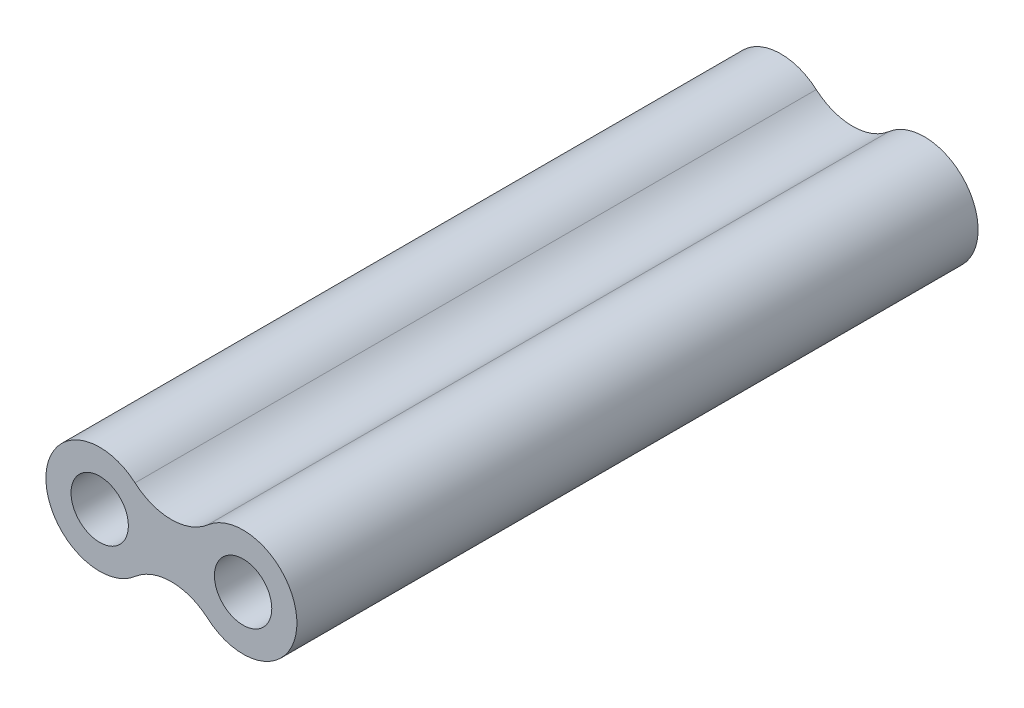
from build123d import *

# Parameters (mm, degrees)
SKETCH1_R                       = 3
BOSS_EXTRUDE1_DEPTH             = 19
M3_CLEARANCE_HOLE1_D            = 3.2
BOSS_EXTRUDE2_REACH             = 21.468
BOSS_EXTRUDE2_DIRECTION_2_REACH = 21.468
M3_CLEARANCE_HOLE2_D            = 3.2


with BuildPart() as part:
    # Sketch1 → Boss-Extrude1 (new, symmetric)
    with BuildSketch(Plane.XY):
        Circle(SKETCH1_R)
    extrude(amount=BOSS_EXTRUDE1_DEPTH, both=True)

    # M3 Clearance Hole1 (through all)
    with Locations(Plane.XY.offset(19)):
        with Locations((0, 0)):
            Hole(M3_CLEARANCE_HOLE1_D / 2)

    # Boss-Extrude2: up to this face of the body (flat: up to its plane)
    boss_extrude2_end = Plane(part.part.faces().sort_by_distance((-2.915147186, 0, 19))[0])
    # Sketch2 → Boss-Extrude2 (add, up to the picked face)
    with BuildSketch(Plane.XY, mode=Mode.PRIVATE) as boss_extrude2_sk1:
        with BuildLine():
            ThreePointArc((6.02739726, -2.260273973), (11, 0), (6.02739726, 2.260273973))
            ThreePointArc((6.02739726, 2.260273973), (4, 1.5), (1.97260274, 2.260273973))
            ThreePointArc((1.97260274, 2.260273973), (3, 0), (1.97260274, -2.260273973))
            ThreePointArc((1.97260274, -2.260273973), (4, -1.5), (6.02739726, -2.260273973))
        make_face()
    boss_extrude2_tool1 = split(extrude(boss_extrude2_sk1.sketch, amount=BOSS_EXTRUDE2_REACH, mode=Mode.PRIVATE), bisect_by=boss_extrude2_end, keep=Keep.BOTH, mode=Mode.PRIVATE)
    add(boss_extrude2_tool1.solids().sort_by(Axis((7.146911, 0, 0), (0, 0, 1)))[0])

    # Boss-Extrude2 direction 2: up to this face of the body (flat: up to its plane)
    boss_extrude2_direction_2_end = Plane(part.part.faces().sort_by_distance((-2.915147186, 0, -19))[0])
    # Sketch2 → Boss-Extrude2 direction 2 (add, up to the picked face)
    with BuildSketch(Plane.XY, mode=Mode.PRIVATE) as boss_extrude2_direction_2_sk1:
        with BuildLine():
            ThreePointArc((6.02739726, -2.260273973), (11, 0), (6.02739726, 2.260273973))
            ThreePointArc((6.02739726, 2.260273973), (4, 1.5), (1.97260274, 2.260273973))
            ThreePointArc((1.97260274, 2.260273973), (3, 0), (1.97260274, -2.260273973))
            ThreePointArc((1.97260274, -2.260273973), (4, -1.5), (6.02739726, -2.260273973))
        make_face()
    boss_extrude2_direction_2_tool1 = split(extrude(boss_extrude2_direction_2_sk1.sketch, amount=-BOSS_EXTRUDE2_DIRECTION_2_REACH, mode=Mode.PRIVATE), bisect_by=boss_extrude2_direction_2_end, keep=Keep.BOTH, mode=Mode.PRIVATE)
    add(boss_extrude2_direction_2_tool1.solids().sort_by(Axis((7.146911, 0, 0), (0, 0, -1)))[0])

    # M3 Clearance Hole2 (through all)
    with Locations(Plane.XY.offset(19)):
        with Locations((8, 0)):
            Hole(M3_CLEARANCE_HOLE2_D / 2)


solid = part.part
